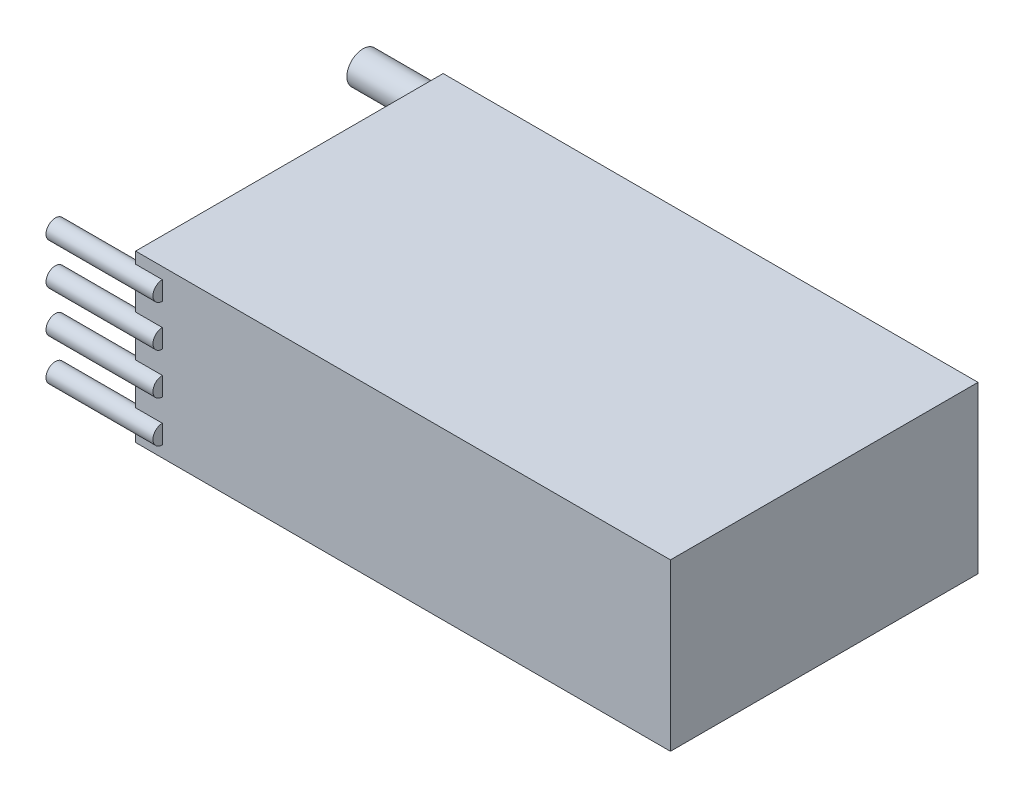
from build123d import *

# Parameters (mm, degrees)
SKETCH1_W                = 50.8
SKETCH1_H                = 29.21
BOSS_EXTRUDE1_DEPTH      = 15.748
BOSS_EXTRUDE2_DEPTH      = 7.62
BOSS_EXTRUDE2_DEPTH_BACK = 2.54
SKETCH2_R                = 1.524
SKETCH2_R_2              = 0.889


with BuildPart() as part:
    # Sketch1 → Boss-Extrude1 (new body)
    with BuildSketch(Plane(origin=(0, 0, 0), x_dir=(1, 0, 0), z_dir=(0, 1, 0))):
        Rectangle(SKETCH1_W, SKETCH1_H)
    extrude(amount=BOSS_EXTRUDE1_DEPTH)

    # Sketch2 → Boss-Extrude2 (add, two sides: drawn at the far end of the back side and taken through both)
    with BuildSketch(Plane.ZY.offset(25.4).offset(-BOSS_EXTRUDE2_DEPTH_BACK)):
        with Locations((-14.605, 12.446)):
            Circle(SKETCH2_R)
        with Locations((14.605, 9.8425)):
            Circle(SKETCH2_R_2)
        with Locations((14.605, 13.7795)):
            Circle(SKETCH2_R_2)
        with Locations((14.605, 5.9055)):
            Circle(SKETCH2_R_2)
        with Locations((14.605, 1.9685)):
            Circle(SKETCH2_R_2)
        with Locations((-14.605, 3.302)):
            Circle(SKETCH2_R)
    extrude(amount=BOSS_EXTRUDE2_DEPTH + BOSS_EXTRUDE2_DEPTH_BACK)


solid = part.part
